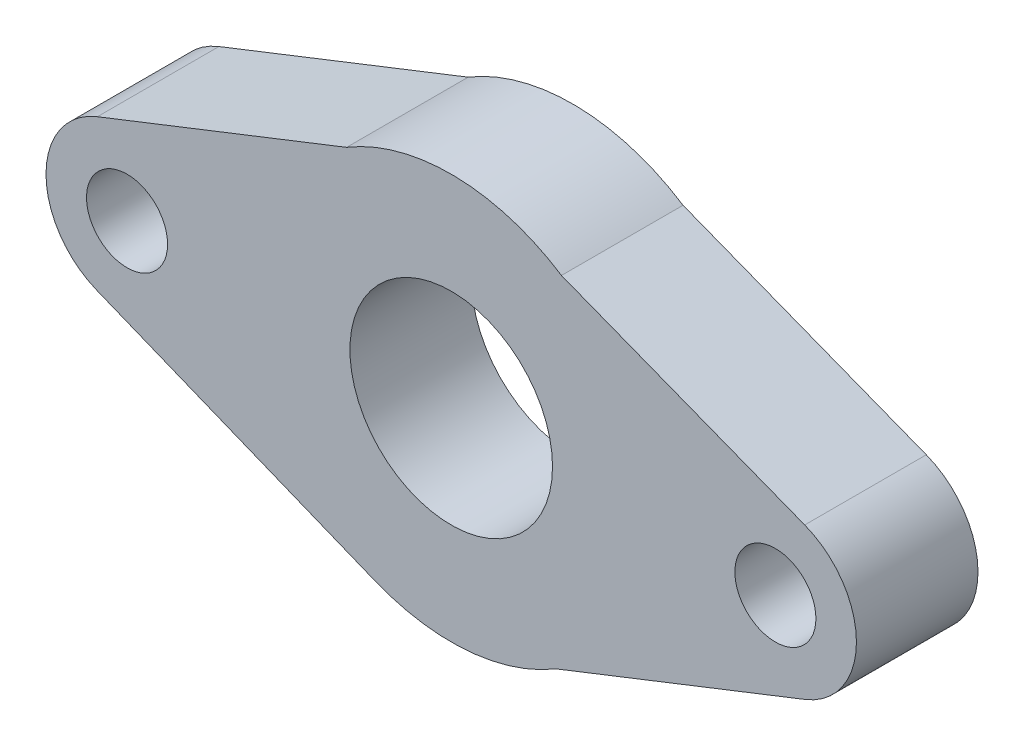
from build123d import *

# Parameters (mm, degrees)
ESBO_O1_R                = 5
ESBO_O1_R_2              = 12.5
RESSALTO_EXTRUS_O1_DEPTH = 15


with BuildPart() as part:
    # Esboço1 → Ressalto-extrusão1 (new body)
    with BuildSketch(Plane.XY):
        with BuildLine():
            Line((-43.662314442, 9.30523793), (-12.910427181, 21.408429882))
            ThreePointArc((-12.910427181, 21.408429882), (0.409231338, 24.99665037), (13.604294544, 20.974345519))
            Line((13.604294544, 20.974345519), (43.61900985, 9.322165398))
            ThreePointArc((43.61900985, 9.322165398), (49.999972977, 0.023247725), (43.662314442, -9.30523793))
            Line((43.662314442, -9.30523793), (12.910427181, -21.408429882))
            ThreePointArc((12.910427181, -21.408429882), (1.892130674, -24.928293995), (-9.531209861, -23.111815995))
            Line((-9.531209861, -23.111815995), (-43.749856986, -9.27030596))
            ThreePointArc((-43.749856986, -9.27030596), (-49.99988895, 0.047127326), (-43.662314442, 9.30523793))
        make_face()
        with Locations((-40, 0)):
            Circle(ESBO_O1_R, mode=Mode.SUBTRACT)
        Circle(ESBO_O1_R_2, mode=Mode.SUBTRACT)
        with Locations((40, 0)):
            Circle(ESBO_O1_R, mode=Mode.SUBTRACT)
    extrude(amount=RESSALTO_EXTRUS_O1_DEPTH)


solid = part.part
